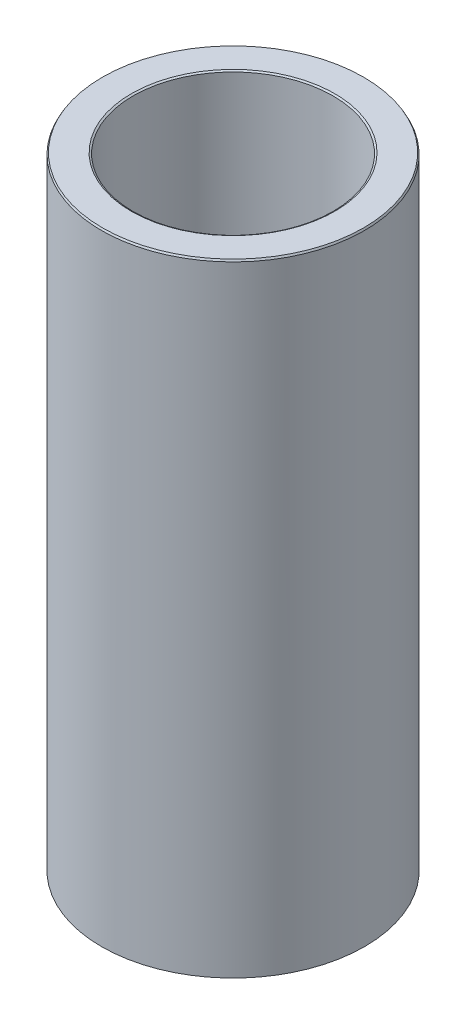
from build123d import *
from OCP.BRepFilletAPI import BRepFilletAPI_MakeChamfer

# Parameters (mm, degrees)
SKETCH1_R           = 25
BOSS_EXTRUDE1_DEPTH = 118.36499238
SKETCH2_R           = 19.012094742
CUT_EXTRUDE1_DEPTH  = 124.53247112
CHAMFER1_SIZE       = 0.333436198
CHAMFER1_SIZE2      = 0.192509479


with BuildPart() as part:
    # Sketch1 → Boss-Extrude1 (new body)
    with BuildSketch(Plane(origin=(0, 0, 0), x_dir=(1, 0, 0), z_dir=(0, 1, 0))):
        Circle(SKETCH1_R)
    extrude(amount=BOSS_EXTRUDE1_DEPTH)

    # Sketch2 → Cut-Extrude1 (cut, through all)
    with BuildSketch(Plane(origin=(0, 0, 0), x_dir=(1, 0, 0), z_dir=(0, 1, 0))):
        Circle(SKETCH2_R)
    extrude(amount=CUT_EXTRUDE1_DEPTH, mode=Mode.SUBTRACT)

    # Chamfer1: one chamfer whose edges measure the first distance from different faces: ONE call of the kernel's chamfer builder (chamfer() names one face for all edges)
    chamfer1_edges_1 = [part.edges().sort_by_distance(p)[0] for p in [
        (-19.012094742, 118.36499238, 0),
    ]]
    chamfer1_side_1 = [part.faces().sort_by_distance(p)[0] for p in [
        (-24.292893219, 118.36499238, 0),
    ]]
    chamfer1_edges_2 = [part.edges().sort_by_distance(p)[0] for p in [
        (-19.012094742, 0, 0),
    ]]
    chamfer1_side_2 = [part.faces().sort_by_distance(p)[0] for p in [
        (-19.012094742, 59.18249619, 0),
    ]]
    chamfer1_edges_3 = [part.edges().sort_by_distance(p)[0] for p in [
        (-25, 0, 0),
    ]]
    chamfer1_side_3 = [part.faces().sort_by_distance(p)[0] for p in [
        (-24.292893219, 0, 0),
    ]]
    chamfer1_edges_4 = [part.edges().sort_by_distance(p)[0] for p in [
        (-25, 118.36499238, 0),
    ]]
    chamfer1_side_4 = [part.faces().sort_by_distance(p)[0] for p in [
        (-25, 59.18249619, 0),
    ]]
    chamfer1 = BRepFilletAPI_MakeChamfer(part.part.solid().wrapped)
    for e in chamfer1_edges_1:
        chamfer1.Add(CHAMFER1_SIZE, CHAMFER1_SIZE2, e.wrapped, chamfer1_side_1[0].wrapped)  # the first distance lies on this face
    for e in chamfer1_edges_2:
        chamfer1.Add(CHAMFER1_SIZE, CHAMFER1_SIZE2, e.wrapped, chamfer1_side_2[0].wrapped)  # the first distance lies on this face
    for e in chamfer1_edges_3:
        chamfer1.Add(CHAMFER1_SIZE, CHAMFER1_SIZE2, e.wrapped, chamfer1_side_3[0].wrapped)  # the first distance lies on this face
    for e in chamfer1_edges_4:
        chamfer1.Add(CHAMFER1_SIZE, CHAMFER1_SIZE2, e.wrapped, chamfer1_side_4[0].wrapped)  # the first distance lies on this face
    add(Compound.cast(chamfer1.Shape()), mode=Mode.REPLACE)


solid = part.part
